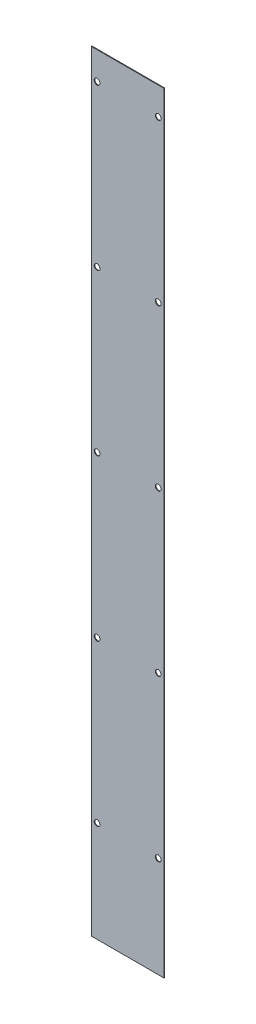
from build123d import *

# Parameters (mm, degrees)
SKETCH1_W          = 76
SKETCH1_H          = 806.5
BASE_FLANGE1_DEPTH = 0.7
SKETCH2_R          = 3
CUT_EXTRUDE1_DEPTH = 10


# Sheet-metal steps are written as plain solids
with BuildPart() as part:
    # Sketch1 → Base-Flange1 (new body)
    with BuildSketch(Plane.XY):
        with Locations((38, 403.25)):
            Rectangle(SKETCH1_W, SKETCH1_H)
    extrude(amount=-BASE_FLANGE1_DEPTH)

    # Sketch2 → Cut-Extrude1 (cut)
    with BuildSketch(Plane.XY):
        with Locations((70, 777.5)):
            Circle(SKETCH2_R)
        with Locations((70, 609.5)):
            Circle(SKETCH2_R)
        with Locations((70, 441.5)):
            Circle(SKETCH2_R)
        with Locations((70, 273.5)):
            Circle(SKETCH2_R)
        with Locations((70, 105.5)):
            Circle(SKETCH2_R)
        with Locations(Location((6, 105.5, 0), (0, 0, 180))):
            Circle(SKETCH2_R)
        with Locations(Location((6, 273.5, 0), (0, 0, 180))):
            Circle(SKETCH2_R)
        with Locations(Location((6, 441.5, 0), (0, 0, 180))):
            Circle(SKETCH2_R)
        with Locations(Location((6, 609.5, 0), (0, 0, 180))):
            Circle(SKETCH2_R)
        with Locations(Location((6, 777.5, 0), (0, 0, 180))):
            Circle(SKETCH2_R)
    extrude(amount=-CUT_EXTRUDE1_DEPTH, mode=Mode.SUBTRACT)


solid = part.part
